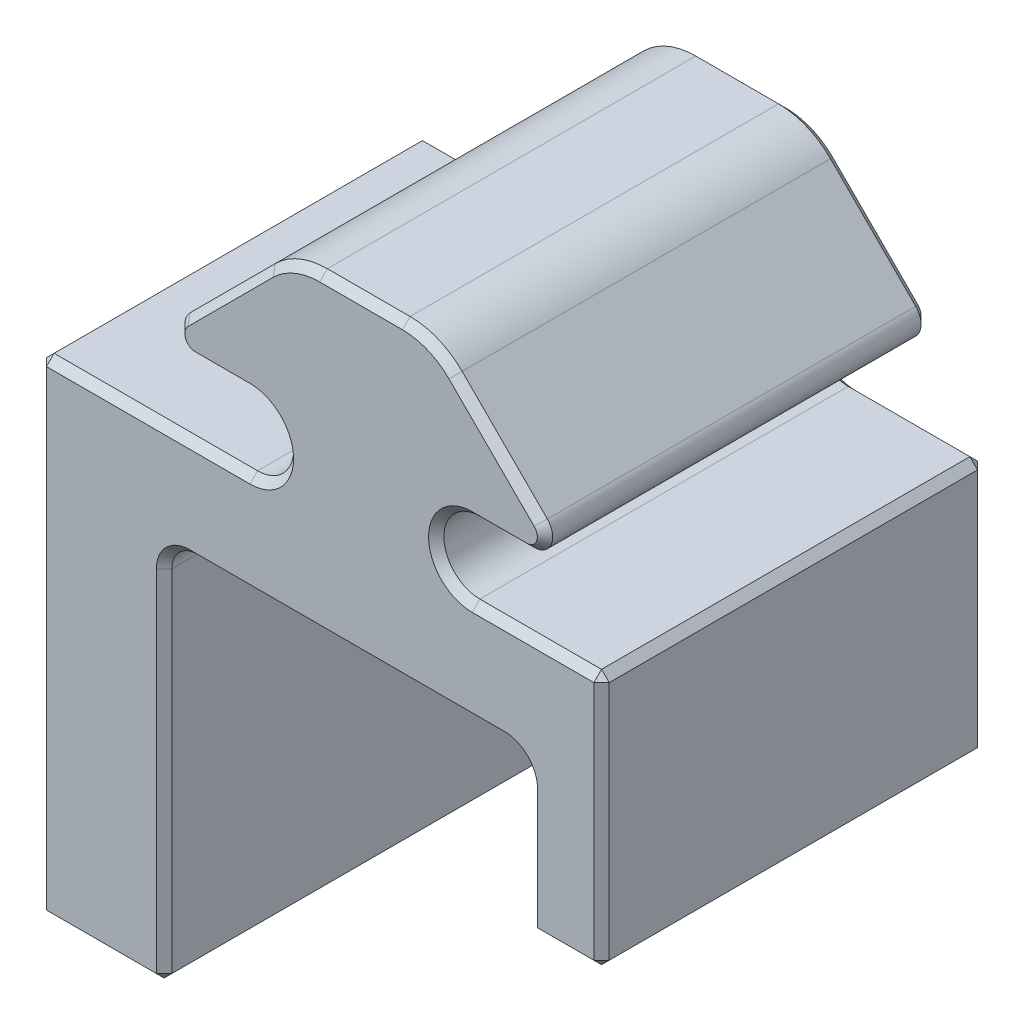
from build123d import *

# Parameters (mm, degrees)
BOSS_EXTRUDE1_DEPTH = 15
SKETCH2_W           = 4.9
SKETCH2_H           = 15
BOSS_EXTRUDE2_DEPTH = 15
SKETCH3_W           = 2.8
SKETCH3_H           = 15
BOSS_EXTRUDE3_DEPTH = 6
FILLET1_R           = 1
CHAMFER1_SIZE       = 0.3


with BuildPart() as part:
    # Sketch1 → Boss-Extrude1 (new body)
    with BuildSketch(Plane.XY):
        with BuildLine():
            Line((4.343399971, -3.4021), (5.0170836, -3.4021))
            Line((5.0170836, -3.4021), (9.4, -3.4021))
            Line((9.4, -3.4021), (9.4, -7.4021))
            Line((9.4, -7.4021), (-12.6, -7.4021))
            Line((-12.6, -7.4021), (-12.6, -3.4021))
            Line((-12.6, -3.4021), (-5.0170836, -3.4021))
            Line((-5.0170836, -3.4021), (-4.3434, -3.4021))
            ThreePointArc((-4.3434, -3.4021), (-2.9385, -1.9972), (-4.3434, -0.5923))
            Line((-4.3434, -0.5923), (-6.474794456, -0.5923))
            ThreePointArc((-6.474794456, -0.5923), (-7.136292201, -0.150301338), (-6.981082911, 0.629988455))
            Line((-6.981082911, 0.629988455), (-3.65103937, 3.960031996))
            ThreePointArc((-3.65103937, 3.960031996), (-2.718322242, 4.583253656), (-1.618107374, 4.8021))
            Line((-1.618107374, 4.8021), (1.618107374, 4.8021))
            ThreePointArc((1.618107374, 4.8021), (2.718322242, 4.583253656), (3.65103937, 3.960031996))
            Line((3.65103937, 3.960031996), (6.981082911, 0.629988455))
            ThreePointArc((6.981082911, 0.629988455), (7.136292201, -0.150301338), (6.474794456, -0.5923))
            Line((6.474794456, -0.5923), (4.343399971, -0.5923))
            ThreePointArc((4.343399971, -0.5923), (2.938499971, -1.9972), (4.343399971, -3.4021))
        make_face()
    extrude(amount=BOSS_EXTRUDE1_DEPTH)

    # Sketch2 → Boss-Extrude2 (add)
    with BuildSketch(Plane.XZ.offset(7.4021)):
        with Locations((-10.15, 7.5)):
            Rectangle(SKETCH2_W, SKETCH2_H)
    extrude(amount=BOSS_EXTRUDE2_DEPTH)

    # Sketch3 → Boss-Extrude3 (add)
    with BuildSketch(Plane.XZ.offset(7.4021)):
        with Locations((8, 7.5)):
            Rectangle(SKETCH3_W, SKETCH3_H)
    extrude(amount=BOSS_EXTRUDE3_DEPTH)

    # Fillet1
    fillet1_edges = [part.edges().sort_by_distance(p)[0] for p in [
        (-7.7, -7.4021, 7.5),
        (6.6, -7.4021, 7.5),
    ]]
    fillet(fillet1_edges, radius=FILLET1_R)

    # Chamfer1
    chamfer1_edges = [part.edges().sort_by_distance(p)[0] for p in [
        (-10.15, -22.4021, 0),
        (-7.7, -15.4021, 0),
        (-0.55, -7.4021, 0),
        (6.6, -10.9021, 0),
        (8, -13.4021, 0),
        (9.4, -8.4021, 0),
        (6.871699986, -3.4021, 0),
        (2.938499971, -1.9972, 0),
        (5.409097213, -0.5923, 0),
        (7.136292201, -0.150301338, 0),
        (5.316061141, 2.295010226, 0),
        (2.718322242, 4.583253656, 0),
        (0, 4.8021, 0),
        (-2.718322242, 4.583253656, 0),
        (-5.316061141, 2.295010226, 0),
        (-7.136292201, -0.150301338, 0),
        (-5.409097228, -0.5923, 0),
        (-2.9385, -1.9972, 0),
        (-8.4717, -3.4021, 0),
        (-12.6, -12.9021, 0),
        (-2.9385, -1.9972, 15),
        (-5.409097228, -0.5923, 15),
        (-7.136292201, -0.150301338, 15),
        (-5.316061141, 2.295010226, 15),
        (-2.718322242, 4.583253656, 15),
        (0, 4.8021, 15),
        (2.718322242, 4.583253656, 15),
        (5.316061141, 2.295010226, 15),
        (7.136292201, -0.150301338, 15),
        (5.409097213, -0.5923, 15),
        (2.938499971, -1.9972, 15),
        (6.871699986, -3.4021, 15),
        (9.4, -8.4021, 15),
        (8, -13.4021, 15),
        (6.6, -10.9021, 15),
        (-0.55, -7.4021, 15),
        (-7.7, -15.4021, 15),
        (-10.15, -22.4021, 15),
        (-12.6, -12.9021, 15),
        (-8.4717, -3.4021, 15),
        (-12.6, -22.4021, 7.5),
        (-7.7, -22.4021, 7.5),
        (6.6, -13.4021, 7.5),
        (9.4, -13.4021, 7.5),
        (9.4, -3.4021, 7.5),
        (-12.6, -3.4021, 7.5),
        (-7.407106781, -7.694993219, 0),
        (6.307106781, -7.694993219, 0),
        (-7.407106781, -7.694993219, 15),
        (6.307106781, -7.694993219, 15),
    ]]
    chamfer(chamfer1_edges, length=CHAMFER1_SIZE)


solid = part.part
